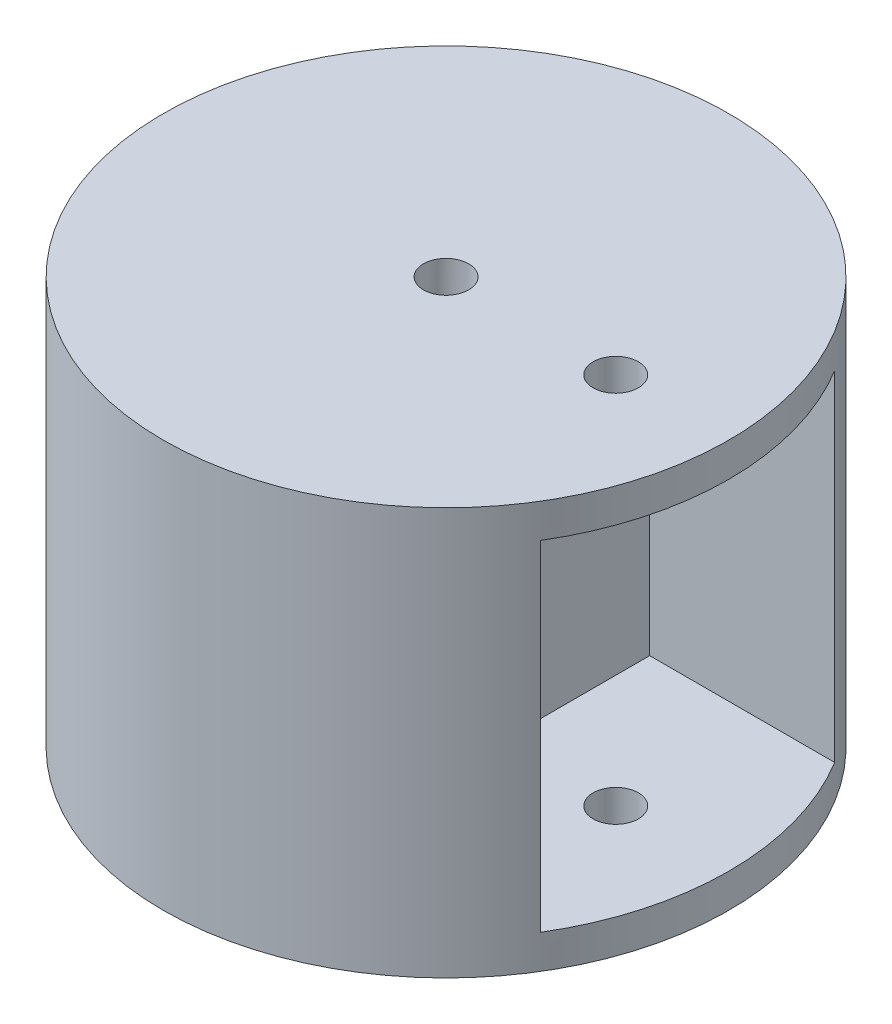
from build123d import *

# Parameters (mm, degrees)
SKETCH1_R           = 12.5
BOSS_EXTRUDE1_DEPTH = 18
SKETCH3_R           = 1
CUT_EXTRUDE2_DEPTH  = 26.228951623
SKETCH6_W           = 13
SKETCH6_H           = 15
CUT_EXTRUDE3_DEPTH  = 10
CUT_EXTRUDE4_DEPTH  = 16
SKETCH7_R           = 1
CUT_EXTRUDE5_DEPTH  = 16


with BuildPart() as part:
    # Sketch1 → Boss-Extrude1 (new body)
    with BuildSketch(Plane(origin=(0, 0, 0), x_dir=(1, 0, 0), z_dir=(0, 1, 0))):
        Circle(SKETCH1_R)
    extrude(amount=BOSS_EXTRUDE1_DEPTH)

    # Sketch3 → Cut-Extrude2 (cut, through all)
    with BuildSketch(Plane.XZ):
        with Locations((7.5, 0)):
            Circle(SKETCH3_R)
    extrude(amount=-CUT_EXTRUDE2_DEPTH, mode=Mode.SUBTRACT)

    # Sketch6 → Cut-Extrude3 (cut)
    with BuildSketch(Plane(origin=(12.5, 0, 0), x_dir=(0, 0, -1), z_dir=(1, 0, 0))):
        with Locations((0, 9)):
            Rectangle(SKETCH6_W, SKETCH6_H)
    extrude(amount=-CUT_EXTRUDE3_DEPTH, mode=Mode.SUBTRACT)

    # Sketch5 → Cut-Extrude4 (cut)
    with BuildSketch(Plane.XZ):
        with BuildLine():
            Line((-1.414213562, 0.5), (-2.514213562, 0.5))
            Line((-2.514213562, 0.5), (-2.514213562, -0.5))
            Line((-2.514213562, -0.5), (-1.414213562, -0.5))
            ThreePointArc((-1.414213562, -0.5), (1.5, 0), (-1.414213562, 0.5))
        make_face()
    extrude(amount=-CUT_EXTRUDE4_DEPTH, mode=Mode.SUBTRACT)

    # Sketch7 → Cut-Extrude5 (cut)
    with BuildSketch(Plane(origin=(0, 18, 0), x_dir=(1, 0, 0), z_dir=(0, 1, 0))):
        Circle(SKETCH7_R)
    extrude(amount=-CUT_EXTRUDE5_DEPTH, mode=Mode.SUBTRACT)


solid = part.part
